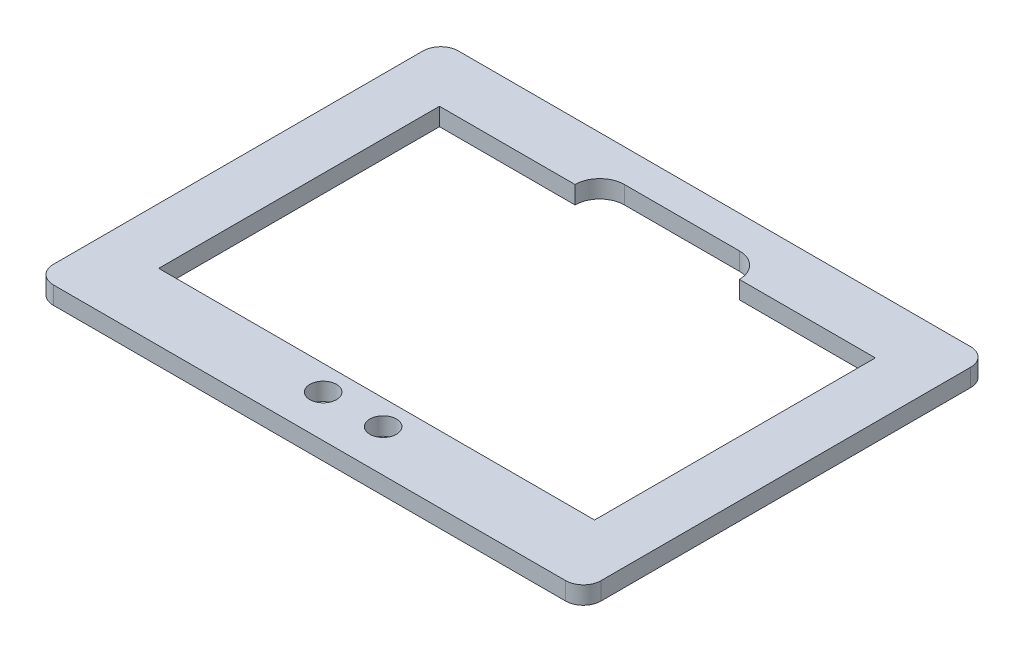
from build123d import *

# Parameters (mm, degrees)
SKETCH1_W           = 78.53
SKETCH1_H           = 58.08
SKETCH1_R           = 1.905
SKETCH1_W_2         = 62.491610006
SKETCH1_H_2         = 40.253760829
BOSS_EXTRUDE1_DEPTH = 2.54
CUT_EXTRUDE1_DEPTH  = 2.54
FILLET1_R           = 2.54


with BuildPart() as part:
    # Sketch1 → Boss-Extrude1 (new body)
    with BuildSketch(Plane(origin=(0, 0, 0), x_dir=(1, 0, 0), z_dir=(0, 1, 0))):
        with Locations((-0.329128556, 0.204655215)):
            Rectangle(SKETCH1_W, SKETCH1_H)
        with Locations((-4.402236218, -22.797237123)):
            Circle(SKETCH1_R, mode=Mode.SUBTRACT)
        with Locations((4.197763782, -22.797237123)):
            Circle(SKETCH1_R, mode=Mode.SUBTRACT)
        with Locations((-0.298250033, 0.894255625)):
            Rectangle(SKETCH1_W_2, SKETCH1_H_2, mode=Mode.SUBTRACT)
    extrude(amount=BOSS_EXTRUDE1_DEPTH)

    # Sketch2 → Cut-Extrude1 (cut)
    with BuildSketch(Plane(origin=(0, 2.54, 0), x_dir=(1, 0, 0), z_dir=(0, 1, 0))):
        with BuildLine():
            Line((-8.568685341, 24.564329148), (7.910428229, 24.564329148))
            ThreePointArc((7.910428229, 24.564329148), (11.453621336, 21.02113604), (7.910428229, 17.477942933))
            Line((7.910428229, 17.477942933), (-8.568685341, 17.477942933))
            ThreePointArc((-8.568685341, 17.477942933), (-12.111878448, 21.02113604), (-8.568685341, 24.564329148))
        make_face()
    extrude(amount=-CUT_EXTRUDE1_DEPTH, mode=Mode.SUBTRACT)

    # Fillet1
    fillet1_edges = [part.edges().sort_by_distance(p)[0] for p in [
        (38.935871444, 1.27, -29.244655215),
        (-39.594128556, 1.27, -29.244655215),
        (-39.594128556, 1.27, 28.835344785),
        (38.935871444, 1.27, 28.835344785),
    ]]
    fillet(fillet1_edges, radius=FILLET1_R)


solid = part.part
